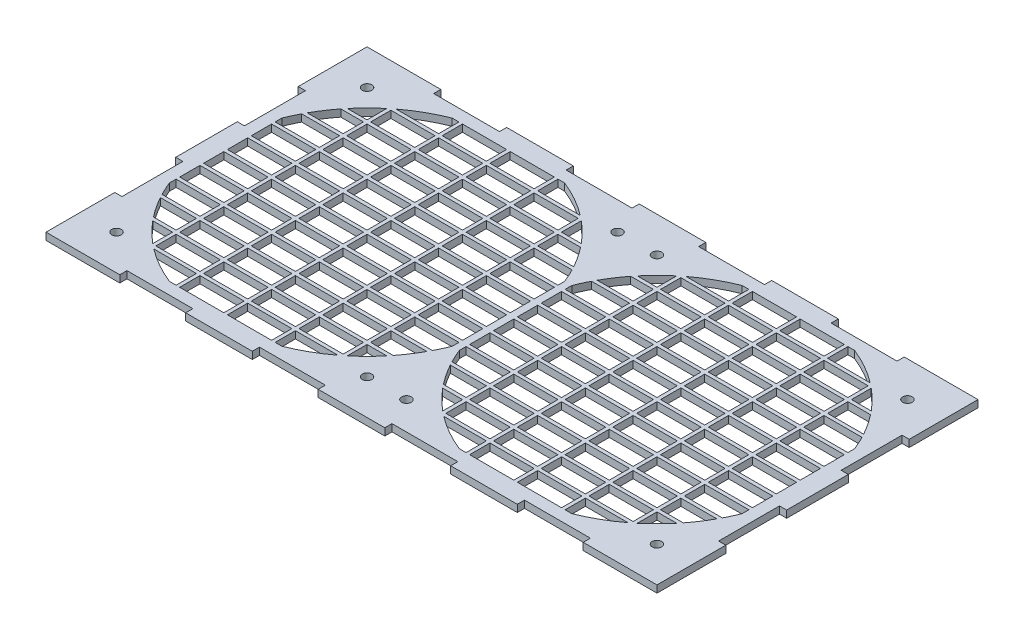
from build123d import *

# Parameters (mm, degrees)
BOSS_EXTRUDE1_DEPTH = 3
SKETCH2_W           = 249.6
SKETCH2_H           = 1.5
BOSS_EXTRUDE2_DEPTH = 3
SKETCH3_W           = 1.5
SKETCH3_H           = 118.3
BOSS_EXTRUDE3_DEPTH = 3
SKETCH4_R           = 2
CUT_EXTRUDE1_DEPTH  = 145.398623608


with BuildPart() as part:
    # Sketch1 → Boss-Extrude1 (new body)
    with BuildSketch(Plane(origin=(0, 0, 0), x_dir=(1, 0, 0), z_dir=(0, 1, 0))):
        Polygon((96.933333333, -64.15), (69.366666667, -64.15), (69.366666667, -67.15), (41.5, -67.15), (41.5, -64.15), (13.933333333, -64.15), (13.933333333, -67.15), (-13.933333333, -67.15), (-13.933333333, -64.15), (-41.5, -64.15), (-41.5, -67.15), (-69.366666667, -67.15), (-69.366666667, -64.15), (-96.933333333, -64.15), (-96.933333333, -67.15), (-124.8, -67.15), (-127.8, -67.15), (-127.8, -38.37), (-124.8, -38.37), (-124.8, -12.89), (-127.8, -12.89), (-127.8, 12.89), (-124.8, 12.89), (-124.8, 38.37), (-127.8, 38.37), (-127.8, 67.15), (-124.8, 67.15), (-96.933333333, 67.15), (-96.933333333, 64.15), (-69.366666667, 64.15), (-69.366666667, 67.15), (-41.5, 67.15), (-41.5, 64.15), (-13.933333333, 64.15), (-13.933333333, 67.15), (13.933333333, 67.15), (13.933333333, 64.15), (41.5, 64.15), (41.5, 67.15), (69.366666667, 67.15), (69.366666667, 64.15), (96.933333333, 64.15), (96.933333333, 67.15), (124.8, 67.15), (127.8, 67.15), (127.8, 64.15), (127.8, 38.37), (124.8, 38.37), (124.8, 12.89), (127.8, 12.89), (127.8, -12.89), (124.8, -12.89), (124.8, -38.37), (127.8, -38.37), (127.8, -64.15), (127.8, -67.15), (124.8, -67.15), (96.933333333, -67.15), align=None)
        with BuildLine():
            Line((-37.142554371, -59.15), (-84.157445629, -59.15))
            ThreePointArc((-84.157445629, -59.15), (-105.657346623, -45.007346623), (-119.8, -23.507445629))
            Line((-119.8, -23.507445629), (-119.8, 23.507445629))
            ThreePointArc((-119.8, 23.507445629), (-105.657346623, 45.007346623), (-84.157445629, 59.15))
            Line((-84.157445629, 59.15), (-37.142554371, 59.15))
            ThreePointArc((-37.142554371, 59.15), (-15.642653377, 45.007346623), (-1.5, 23.507445629))
            Line((-1.5, 23.507445629), (-1.5, -23.507445629))
            ThreePointArc((-1.5, -23.507445629), (-15.642653377, -45.007346623), (-37.142554371, -59.15))
        make_face(mode=Mode.SUBTRACT)
        with BuildLine():
            Line((84.157445629, -59.15), (37.142554371, -59.15))
            ThreePointArc((37.142554371, -59.15), (15.642653377, -45.007346623), (1.5, -23.507445629))
            Line((1.5, -23.507445629), (1.5, 23.507445629))
            ThreePointArc((1.5, 23.507445629), (15.642653377, 45.007346623), (37.142554371, 59.15))
            Line((37.142554371, 59.15), (84.157445629, 59.15))
            ThreePointArc((84.157445629, 59.15), (105.657346623, 45.007346623), (119.8, 23.507445629))
            Line((119.8, 23.507445629), (119.8, -23.507445629))
            ThreePointArc((119.8, -23.507445629), (105.657346623, -45.007346623), (84.157445629, -59.15))
        make_face(mode=Mode.SUBTRACT)
    extrude(amount=BOSS_EXTRUDE1_DEPTH)

    # Sketch2 → Boss-Extrude2 (add, through all)
    with BuildSketch(Plane(origin=(0, 3, 0), x_dir=(1, 0, 0), z_dir=(0, 1, 0))):
        with Locations((0, 59.9)):
            Rectangle(SKETCH2_W, SKETCH2_H)
        with Locations((0, 49.916666667)):
            Rectangle(SKETCH2_W, SKETCH2_H)
        with Locations((0, 39.933333333)):
            Rectangle(SKETCH2_W, SKETCH2_H)
        with Locations((0, 29.95)):
            Rectangle(SKETCH2_W, SKETCH2_H)
        with Locations((0, 19.966666667)):
            Rectangle(SKETCH2_W, SKETCH2_H)
        with Locations((0, 9.983333333)):
            Rectangle(SKETCH2_W, SKETCH2_H)
        Rectangle(SKETCH2_W, SKETCH2_H)
        with Locations((0, -9.983333333)):
            Rectangle(SKETCH2_W, SKETCH2_H)
        with Locations((0, -19.966666667)):
            Rectangle(SKETCH2_W, SKETCH2_H)
        with Locations((0, -29.95)):
            Rectangle(SKETCH2_W, SKETCH2_H)
        with Locations((0, -39.933333333)):
            Rectangle(SKETCH2_W, SKETCH2_H)
        with Locations((0, -49.916666667)):
            Rectangle(SKETCH2_W, SKETCH2_H)
        with Locations((0, -59.9)):
            Rectangle(SKETCH2_W, SKETCH2_H)
    extrude(amount=-BOSS_EXTRUDE2_DEPTH)

    # Sketch3 → Boss-Extrude3 (add, through all)
    with BuildSketch(Plane(origin=(0, 3, 0), x_dir=(1, 0, 0), z_dir=(0, 1, 0))):
        with Locations((0.75, 0)):
            Rectangle(SKETCH3_W, SKETCH3_H)
        with Locations((-0.75, 0)):
            Rectangle(SKETCH3_W, SKETCH3_H)
        with Locations((-20.716666667, 0)):
            Rectangle(SKETCH3_W, SKETCH3_H)
        with Locations((40.683333333, 0)):
            Rectangle(SKETCH3_W, SKETCH3_H)
        with Locations((-60.65, 0)):
            Rectangle(SKETCH3_W, SKETCH3_H)
        with Locations((20.716666667, 0)):
            Rectangle(SKETCH3_W, SKETCH3_H)
        with Locations((60.65, 0)):
            Rectangle(SKETCH3_W, SKETCH3_H)
        with Locations((80.616666667, 0)):
            Rectangle(SKETCH3_W, SKETCH3_H)
        with Locations((100.583333333, 0)):
            Rectangle(SKETCH3_W, SKETCH3_H)
        with Locations((120.55, 0)):
            Rectangle(SKETCH3_W, SKETCH3_H)
        with Locations((-40.683333333, 0)):
            Rectangle(SKETCH3_W, SKETCH3_H)
        with Locations((-80.616666667, 0)):
            Rectangle(SKETCH3_W, SKETCH3_H)
        with Locations((-100.583333333, 0)):
            Rectangle(SKETCH3_W, SKETCH3_H)
        with Locations((-120.55, 0)):
            Rectangle(SKETCH3_W, SKETCH3_H)
    extrude(amount=-BOSS_EXTRUDE3_DEPTH)

    # Sketch4 → Cut-Extrude1 (cut, through all)
    with BuildSketch(Plane(origin=(0, 3, 0), x_dir=(1, 0, 0), z_dir=(0, 1, 0))):
        with Locations(Location((-113.05, 52.4, 0), (0, 0, 270))):
            Circle(SKETCH4_R)
        with Locations(Location((-8.25, 52.4, 0), (0, 0, 270))):
            Circle(SKETCH4_R)
        with Locations(Location((8.25, 52.4, 0), (0, 0, 270))):
            Circle(SKETCH4_R)
        with Locations(Location((113.05, 52.4, 0), (0, 0, 270))):
            Circle(SKETCH4_R)
        with Locations(Location((113.05, -52.4, 0), (0, 0, 270))):
            Circle(SKETCH4_R)
        with Locations(Location((8.25, -52.4, 0), (0, 0, 270))):
            Circle(SKETCH4_R)
        with Locations(Location((-8.25, -52.4, 0), (0, 0, 270))):
            Circle(SKETCH4_R)
        with Locations(Location((-113.05, -52.4, 0), (0, 0, 270))):
            Circle(SKETCH4_R)
    extrude(amount=-CUT_EXTRUDE1_DEPTH, mode=Mode.SUBTRACT)


solid = part.part
